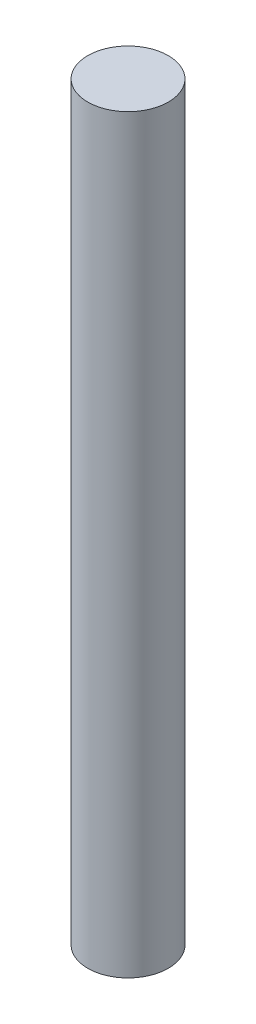
from build123d import *

# Parameters (mm, degrees)
SKETCH_2_R      = 35
SKETCH_2_R_2    = 34
EXTRUDE_1_DEPTH = 650
EXTRUDE_START   = 1
SKETCH_3_R      = 35
EXTRUDE_2_DEPTH = 1
SKETCH_4_R      = 35
EXTRUDE_3_DEPTH = 1


with BuildPart() as part:
    # Эскиз2 → Бобышка-Вытянуть1 (new body)
    with BuildSketch(Plane(origin=(0, 0, 0), x_dir=(1, 0, 0), z_dir=(0, 1, 0))):
        Circle(SKETCH_2_R)
        Circle(SKETCH_2_R_2, mode=Mode.SUBTRACT)
    extrude(amount=EXTRUDE_1_DEPTH)

    # Эскиз3 → Бобышка-Вытянуть2 (add)
    with BuildSketch(Plane.XZ.offset(EXTRUDE_START)):
        Circle(SKETCH_3_R)
    extrude(amount=-EXTRUDE_2_DEPTH)

    # Эскиз4 → Бобышка-Вытянуть3 (add)
    with BuildSketch(Plane(origin=(0, 650, 0), x_dir=(1, 0, 0), z_dir=(0, 1, 0))):
        Circle(SKETCH_4_R)
    extrude(amount=EXTRUDE_3_DEPTH)


solid = part.part
